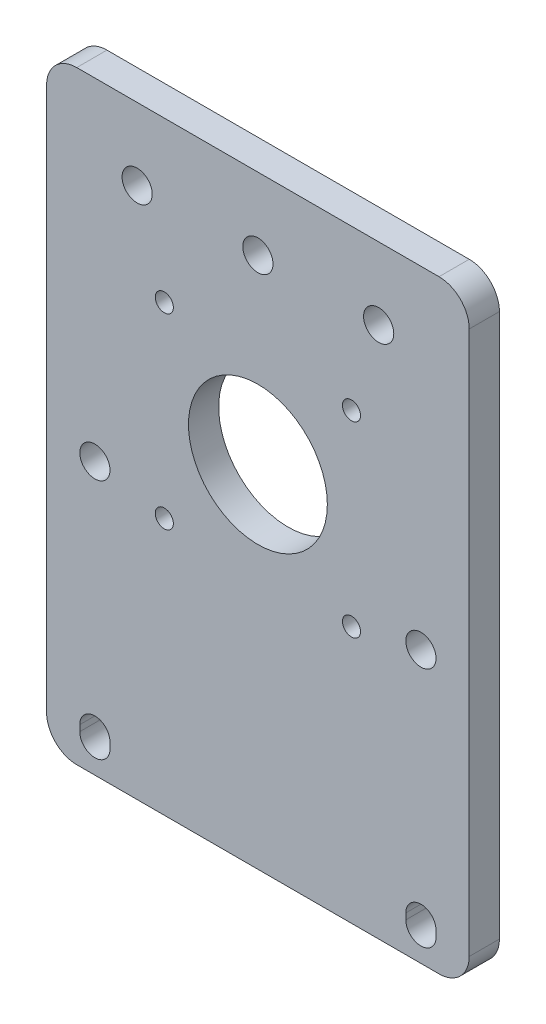
from build123d import *

# Parameters (mm, degrees)
SKETCH4_W           = 70
SKETCH4_H           = 100
SKETCH4_R           = 2.5
BOSS_EXTRUDE2_DEPTH = 5
SKETCH5_R           = 11.5
SKETCH5_R_2         = 1.5
CUT_EXTRUDE2_DEPTH  = 62.23724357
SKETCH6_R           = 2.5
CUT_EXTRUDE3_DEPTH  = 62.23724357
FILLET1_R           = 5


with BuildPart() as part:
    # Sketch4 → Boss-Extrude2 (new body)
    with BuildSketch(Plane.XY):
        Rectangle(SKETCH4_W, SKETCH4_H)
        with Locations((-27, -5)):
            Circle(SKETCH4_R, mode=Mode.SUBTRACT)
        with Locations((27, -5)):
            Circle(SKETCH4_R, mode=Mode.SUBTRACT)
        with BuildLine():
            Line((-24.5, -44), (-24.5, -45))
            ThreePointArc((-24.5, -45), (-27, -47.5), (-29.5, -45))
            Line((-29.5, -45), (-29.5, -44))
            ThreePointArc((-29.5, -44), (-27, -41.5), (-24.5, -44))
        make_face(mode=Mode.SUBTRACT)
        with BuildLine():
            Line((24.5, -44), (24.5, -45))
            ThreePointArc((24.5, -45), (27, -47.5), (29.5, -45))
            Line((29.5, -45), (29.5, -44))
            ThreePointArc((29.5, -44), (27, -41.5), (24.5, -44))
        make_face(mode=Mode.SUBTRACT)
    extrude(amount=BOSS_EXTRUDE2_DEPTH)

    # Sketch5 → Cut-Extrude2 (cut, through all)
    with BuildSketch(Plane.XY.offset(5)):
        with Locations((0, 8.076696831)):
            Circle(SKETCH5_R)
        with Locations((-15.5, 23.576696831)):
            Circle(SKETCH5_R_2)
        with Locations((15.5, 23.576696831)):
            Circle(SKETCH5_R_2)
        with Locations((15.5, -7.423303169)):
            Circle(SKETCH5_R_2)
        with Locations((-15.5, -7.423303169)):
            Circle(SKETCH5_R_2)
    extrude(amount=-CUT_EXTRUDE2_DEPTH, mode=Mode.SUBTRACT)

    # Sketch6 → Cut-Extrude3 (cut, through all)
    with BuildSketch(Plane.XY.offset(5)):
        with Locations((20, 38.076696831)):
            Circle(SKETCH6_R)
        with Locations((-20, 38.076696831)):
            Circle(SKETCH6_R)
        with Locations((0, 38.076696831)):
            Circle(SKETCH6_R)
    extrude(amount=-CUT_EXTRUDE3_DEPTH, mode=Mode.SUBTRACT)

    # Fillet1
    fillet1_edges = [part.edges().sort_by_distance(p)[0] for p in [
        (-35, -50, 2.5),
        (35, -50, 2.5),
        (35, 50, 2.5),
        (-35, 50, 2.5),
    ]]
    fillet(fillet1_edges, radius=FILLET1_R)


solid = part.part
